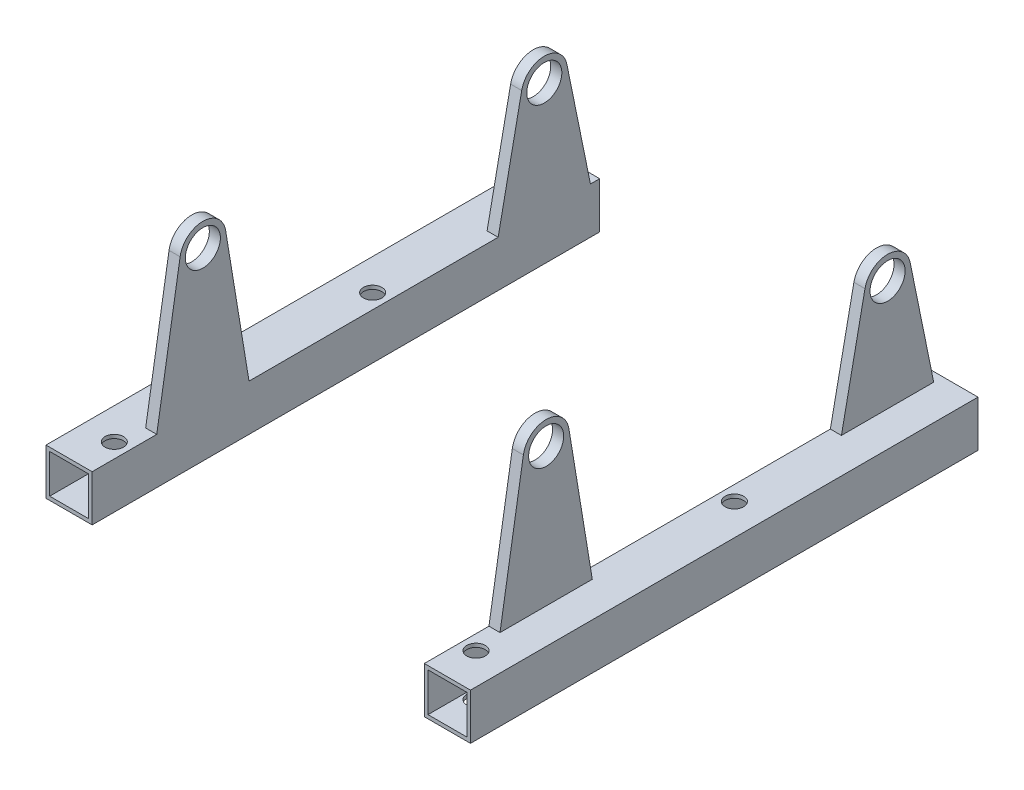
from build123d import *

# Parameters (mm, degrees)
BOSS_EXTRUDE1_DEPTH = 12.5
SHELL1_START        = -113
SHELL1_OUTLINE_W    = 21
SHELL1_OUTLINE_H    = 306
SHELL1_DEPTH        = 21
SHELL1_START_2      = 92
SHELL1_2_OUTLINE_W  = 21
SHELL1_2_OUTLINE_H  = 306
SHELL1_2_DEPTH      = 21
SHELL1_START_3      = -92
SHELL1_3_OUTLINE_W  = 21
SHELL1_3_OUTLINE_H  = 21
SHELL1_3_DEPTH      = 184
SKETCH6_R           = 9.5
BOSS_EXTRUDE5_DEPTH = 6
LPATTERN1_COUNT     = 2
LPATTERN1_PITCH     = 186
SKETCH9_R           = 9.5
BOSS_EXTRUDE6_DEPTH = 6
SKETCH10_W          = 180
SKETCH10_H          = 25
CUT_EXTRUDE1_DEPTH  = 212.910948278
SKETCH11_R          = 5
CUT_EXTRUDE2_DEPTH  = 212.910948278
SKETCH12_W          = 230
SKETCH12_H          = 35
CUT_EXTRUDE3_DEPTH  = 212.910948278
SKETCH13_W          = 21
SKETCH13_H          = 21
BOSS_EXTRUDE7_DEPTH = 2
SKETCH14_W          = 21
SKETCH14_H          = 21
BOSS_EXTRUDE8_DEPTH = 2
SKETCH16_W          = 21
SKETCH16_H          = 21
CUT_EXTRUDE5_DEPTH  = 275


# Read off the part's stored shape, not the designer's step: Shell1
with BuildPart() as part:
    # Sketch1 → Boss-Extrude1 (new, symmetric)
    with BuildSketch(Plane(origin=(0, 0, 0), x_dir=(1, 0, 0), z_dir=(0, 1, 0))):
        Polygon((-115, -155), (-115, 155), (-90, 155), (-90, 130), (-90, -130), (90, -130), (90, 130), (90, 155), (115, 155), (115, -155), align=None)
    extrude(amount=BOSS_EXTRUDE1_DEPTH, both=True)

    # Shell1 outline → Shell1 (cut)
    with BuildSketch(Plane.YZ.offset(SHELL1_START)):
        Rectangle(SHELL1_OUTLINE_W, SHELL1_OUTLINE_H)
    extrude(amount=SHELL1_DEPTH, mode=Mode.SUBTRACT)

    # Shell1 2 outline → Shell1 2 (cut)
    with BuildSketch(Plane.YZ.offset(SHELL1_START_2)):
        Rectangle(SHELL1_2_OUTLINE_W, SHELL1_2_OUTLINE_H)
    extrude(amount=SHELL1_2_DEPTH, mode=Mode.SUBTRACT)

    # Shell1 3 outline → Shell1 3 (cut)
    with BuildSketch(Plane.YZ.offset(SHELL1_START_3)):
        with Locations((0, 142.5)):
            Rectangle(SHELL1_3_OUTLINE_W, SHELL1_3_OUTLINE_H)
    extrude(amount=SHELL1_3_DEPTH, mode=Mode.SUBTRACT)

    # Sketch6 → Boss-Extrude5 (add)
    with BuildSketch(Plane(origin=(-90, 0, 0), x_dir=(0, 0, -1), z_dir=(1, 0, 0))):
        with BuildLine():
            Line((-107.334371247, 89.528123749), (-120, 12.5))
            Line((-120, 12.5), (-70, 12.5))
            Line((-70, 12.5), (-82.665628753, 89.528123749))
            ThreePointArc((-82.665628753, 89.528123749), (-95, 100), (-107.334371247, 89.528123749))
        make_face()
        with Locations((-95, 87.5)):
            Circle(SKETCH6_R, mode=Mode.SUBTRACT)
    boss_extrude5 = extrude(amount=-BOSS_EXTRUDE5_DEPTH)

    # LPattern1: Boss-Extrude5 ×2
    with Locations(*[(i * LPATTERN1_PITCH, 0, 0) for i in range(1, LPATTERN1_COUNT)]):
        add(boss_extrude5)

    # Sketch9 → Boss-Extrude6 (add)
    with BuildSketch(Plane.ZY.offset(-90)):
        with BuildLine():
            Line((-77.752351341, 74.999020274), (-65, 12.5))
            Line((-65, 12.5), (-115, 12.5))
            Line((-115, 12.5), (-102.247648659, 74.999020274))
            ThreePointArc((-102.247648659, 74.999020274), (-90, 85), (-77.752351341, 74.999020274))
        make_face()
        with Locations((-90, 72.5)):
            Circle(SKETCH9_R, mode=Mode.SUBTRACT)
    boss_extrude6 = extrude(amount=-BOSS_EXTRUDE6_DEPTH)

    # Mirror1: Boss-Extrude6 across plane
    add(boss_extrude6.mirror(Plane(origin=(0, 0, 0), x_dir=(0, 0, 1), z_dir=(1, 0, 0))))

    # Sketch10 → Cut-Extrude1 (cut, through all)
    with BuildSketch(Plane(origin=(0, 12.5, 0), x_dir=(1, 0, 0), z_dir=(0, 1, 0))):
        with Locations((0, -142.5)):
            Rectangle(SKETCH10_W, SKETCH10_H)
    extrude(amount=-CUT_EXTRUDE1_DEPTH, mode=Mode.SUBTRACT)


with BuildPart() as cut_extrude1_piece_1:
    # of the separate pieces the step leaves, piece 1, a body of its own (cut_extrude1_pieces)
    add(part.part.solids().sort_by_distance((115, -12.5, 155))[0])


with BuildPart() as cut_extrude1_piece_2:
    # of the separate pieces the step leaves, piece 2, a body of its own (cut_extrude1_pieces)
    add(part.part.solids().sort_by_distance((-115, -12.5, 155))[0])


with BuildPart() as cut_extrude2_tool:
    # Sketch11 → Cut-Extrude2 (new, through all)
    with BuildSketch(Plane(origin=(0, 12.5, 0), x_dir=(1, 0, 0), z_dir=(0, 1, 0))):
        with Locations(Location((-98, 5, 0), (0, 0, 270))):
            Circle(SKETCH11_R)
        with Locations(Location((-98, -135, 0), (0, 0, 270))):
            Circle(SKETCH11_R)
        with Locations(Location((98, -135, 0), (0, 0, 90))):
            Circle(SKETCH11_R)
        with Locations(Location((98, 5, 0), (0, 0, 90))):
            Circle(SKETCH11_R)
    extrude(amount=-CUT_EXTRUDE2_DEPTH)


with BuildPart() as cut_extrude1_piece_1_1:
    add(cut_extrude1_piece_1.part)

    # Cut-Extrude2: cut by cut_extrude2_tool
    add(cut_extrude2_tool.part, mode=Mode.SUBTRACT)


with BuildPart() as cut_extrude1_piece_2_1:
    add(cut_extrude1_piece_2.part)

    # Cut-Extrude2: cut by cut_extrude2_tool
    add(cut_extrude2_tool.part, mode=Mode.SUBTRACT)


with BuildPart() as cut_extrude3_tool:
    # Sketch12 → Cut-Extrude3 (new, through all)
    with BuildSketch(Plane(origin=(0, 12.5, 0), x_dir=(1, 0, 0), z_dir=(0, 1, 0))):
        with Locations((0, 137.5)):
            Rectangle(SKETCH12_W, SKETCH12_H)
    extrude(amount=-CUT_EXTRUDE3_DEPTH)


with BuildPart() as cut_extrude1_piece_1_2:
    add(cut_extrude1_piece_1_1.part)

    # Cut-Extrude3: cut by cut_extrude3_tool
    add(cut_extrude3_tool.part, mode=Mode.SUBTRACT)

    # Sketch13 → Boss-Extrude7 (add)
    with BuildSketch(Plane(origin=(92, 0, 0), x_dir=(0, 0, -1), z_dir=(1, 0, 0))):
        with Locations((-142.5, 0)):
            Rectangle(SKETCH13_W, SKETCH13_H)
    extrude(amount=-BOSS_EXTRUDE7_DEPTH)


with BuildPart() as cut_extrude1_piece_2_2:
    add(cut_extrude1_piece_2_1.part)

    # Cut-Extrude3: cut by cut_extrude3_tool
    add(cut_extrude3_tool.part, mode=Mode.SUBTRACT)

    # Sketch14 → Boss-Extrude8 (add)
    with BuildSketch(Plane.ZY.offset(92)):
        with Locations((142.5, 0)):
            Rectangle(SKETCH14_W, SKETCH14_H)
    extrude(amount=-BOSS_EXTRUDE8_DEPTH)


with BuildPart() as cut_extrude5_tool:
    # Sketch16 → Cut-Extrude5 (new body)
    with BuildSketch(Plane(origin=(0, 0, -120), x_dir=(-1, 0, 0), z_dir=(0, 0, -1))):
        with Locations((-102.5, 0)):
            Rectangle(SKETCH16_W, SKETCH16_H)
        with Locations((102.5, 0)):
            Rectangle(SKETCH16_W, SKETCH16_H)
    extrude(amount=-CUT_EXTRUDE5_DEPTH)


with BuildPart() as cut_extrude1_piece_1_3:
    add(cut_extrude1_piece_1_2.part)

    # Cut-Extrude5: cut by cut_extrude5_tool
    add(cut_extrude5_tool.part, mode=Mode.SUBTRACT)


with BuildPart() as cut_extrude1_piece_2_3:
    add(cut_extrude1_piece_2_2.part)

    # Cut-Extrude5: cut by cut_extrude5_tool
    add(cut_extrude5_tool.part, mode=Mode.SUBTRACT)


solid = Compound([cut_extrude1_piece_1_3.part, cut_extrude1_piece_2_3.part])
